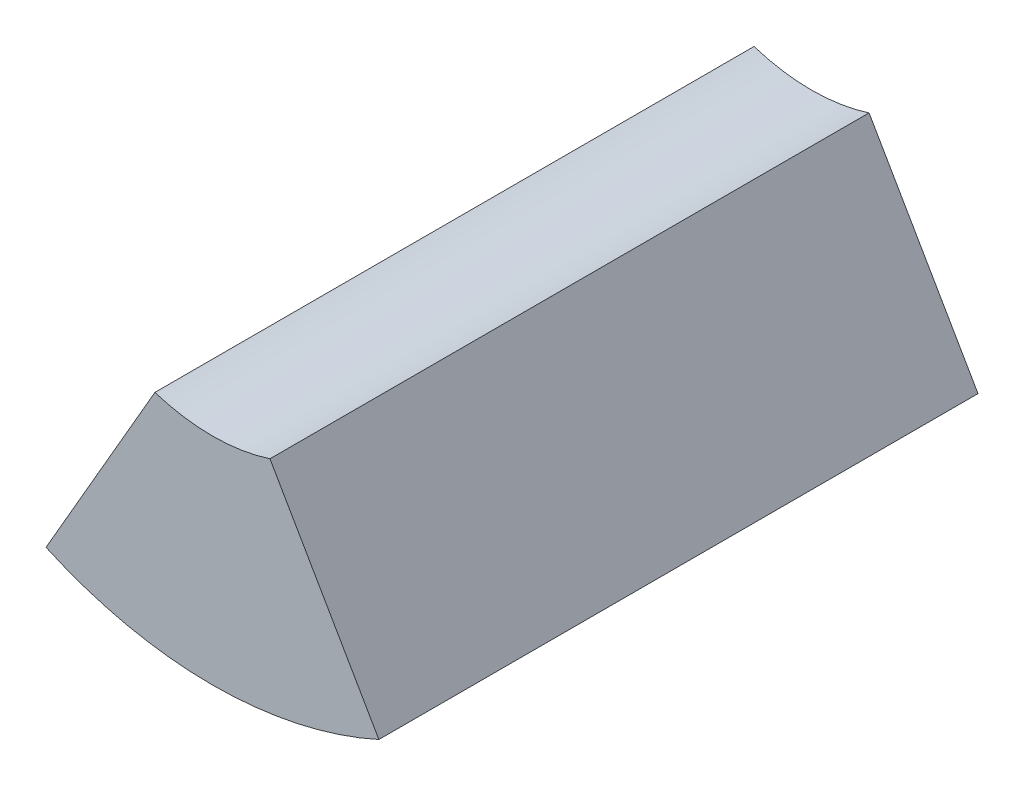
from build123d import *

# Parameters (mm, degrees)
SKETCH1_W           = 31.75
SKETCH1_H           = 19.05
BOSS_EXTRUDE1_DEPTH = 50.8
CUT_EXTRUDE1_DEPTH  = 63.861792847
CUT_EXTRUDE2_START  = -50.8
CUT_EXTRUDE2_DEPTH  = 50.8


# Read off the part's stored shape, not the designer's step: Cut-Extrude2
with BuildPart() as part:
    # Sketch1 → Boss-Extrude1 (new body)
    with BuildSketch(Plane.XY):
        with Locations((15.875, 9.525)):
            Rectangle(SKETCH1_W, SKETCH1_H)
    extrude(amount=-BOSS_EXTRUDE1_DEPTH)

    # Sketch2 → Cut-Extrude1 (cut, through all)
    with BuildSketch(Plane.XY):
        Polygon((0, 19.05), (0, 0), (10.998522628, 19.05), align=None)
        Polygon((31.75, 19.05), (31.75, 0), (20.751477372, 19.05), align=None)
    extrude(amount=-CUT_EXTRUDE1_DEPTH, mode=Mode.SUBTRACT)

    # Cut-Extrude2 outline → Cut-Extrude2 (cut)
    with BuildSketch(Plane.XY.offset(CUT_EXTRUDE2_START)):
        with BuildLine():
            Line((20.751477372, 19.05), (10.998522628, 19.05))
            ThreePointArc((10.998522628, 19.05), (15.875, 18.282468135), (20.751477372, 19.05))
        make_face()
        with BuildLine():
            ThreePointArc((15.875, 0), (8.655401308, 0.77169236), (1.762015854, 3.051900982))
            Line((1.762015854, 3.051900982), (0, 0))
            Line((0, 0), (15.875, 0))
        make_face()
        with BuildLine():
            Line((31.75, 0), (29.987984146, 3.051900982))
            ThreePointArc((29.987984146, 3.051900982), (23.094598692, 0.77169236), (15.875, 0))
            Line((15.875, 0), (31.75, 0))
        make_face()
    extrude(amount=CUT_EXTRUDE2_DEPTH, mode=Mode.SUBTRACT)


solid = part.part
